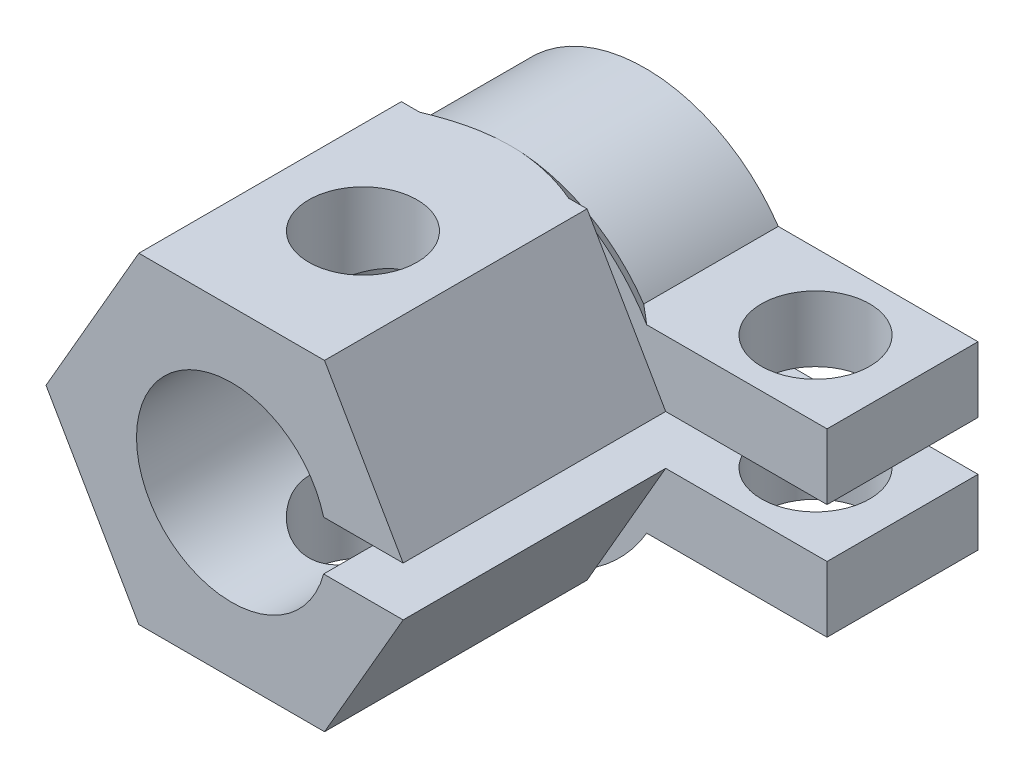
from build123d import *

# Parameters (mm, degrees)
CROQUIS1_R                 = 4.9
CROQUIS1_R_2               = 2.9
SALIENTE_EXTRUIR1_DEPTH    = 4.6
CORTAR_EXTRUIR2_DEPTH      = 0.75
CORTAR_EXTRUIR2_DEPTH_BACK = 0.75
CROQUIS2_W                 = 2.8
CROQUIS2_H                 = 4.6
CROQUIS4_R                 = 1.65
SALIENTE_EXTRUIR2_DEPTH    = 2
SALIENTE_EXTRUIR3_DEPTH    = 8
CORTAR_EXTRUIR3_DEPTH      = 19.912045786
CORTAR_EXTRUIR3_DEPTH_BACK = 19.912045786
CROQUIS6_R                 = 1.65
CHAFL_N1_SIZE              = 0.5


with BuildPart() as part:
    # Croquis1 → Saliente-Extruir1 (new body)
    with BuildSketch(Plane.XY):
        Circle(CROQUIS1_R)
        Circle(CROQUIS1_R_2, mode=Mode.SUBTRACT)
    extrude(amount=SALIENTE_EXTRUIR1_DEPTH)

    # Croquis2 → Cortar-Extruir2 (cut, two sides: drawn at the far end of the back side and taken through both)
    with BuildSketch(Plane(origin=(0, 0, 0), x_dir=(1, 0, 0), z_dir=(0, 1, 0)).offset(-CORTAR_EXTRUIR2_DEPTH_BACK)):
        with Locations((3.6, -2.3)):
            Rectangle(CROQUIS2_W, CROQUIS2_H)
    extrude(amount=CORTAR_EXTRUIR2_DEPTH + CORTAR_EXTRUIR2_DEPTH_BACK, mode=Mode.SUBTRACT)



with BuildPart() as body_2:
    # Croquis4 → Saliente-Extruir2 (new body)
    with BuildSketch(Plane(origin=(0, -0.75, 0), x_dir=(1, 0, 0), z_dir=(0, 1, 0))):
        Polygon((4.842261868, -4.6), (10.142261868, -4.6), (10.142261868, 0), (4.842261868, 0), (2.801338966, 0), (2.801338966, -4.6), align=None)
        with Locations(Location((7.492261868, -2.3, 0), (0, 0, 270))):
            Circle(CROQUIS4_R, mode=Mode.SUBTRACT)
    extrude(amount=-SALIENTE_EXTRUIR2_DEPTH)


with BuildPart() as body_3:
    # Simetría3: mirrored copy
    add(body_2.part.mirror(Plane.ZX))


with BuildPart() as part_1:
    add(part.part)

    add(body_2.part)  # Saliente-Extruir3 merges body 2

    add(body_3.part)  # Saliente-Extruir3 merges body 3
    # Croquis5 → Saliente-Extruir3 (add)
    with BuildSketch(Plane.XY.offset(4.6)):
        with BuildLine():
            ThreePointArc((2.801338966, -0.75), (-2.9, 0), (2.801338966, 0.75))
            Line((2.801338966, 0.75), (4.842261868, 0.75))
            ThreePointArc((4.842261868, 0.75), (-4.9, 0), (4.842261868, -0.75))
            Line((4.842261868, -0.75), (2.801338966, -0.75))
        make_face()
        with BuildLine():
            Line((-2.829016319, 4.9), (-4.243524531, 2.449999908))
            ThreePointArc((-4.243524531, 2.449999908), (-2.450000051, 4.243524449), (-1.2e-08, 4.9))
            Line((-1.2e-08, 4.9), (-2.829016319, 4.9))
        make_face()
        with BuildLine():
            Line((-5.658032638, 0), (-4.243524553, -2.449999871))
            ThreePointArc((-4.243524553, -2.449999871), (-4.9, 2.1e-08), (-4.243524531, 2.449999908))
            Line((-4.243524531, 2.449999908), (-5.658032638, 0))
        make_face()
        with BuildLine():
            Line((-2.829016319, -4.9), (-1.5e-08, -4.9))
            ThreePointArc((-1.5e-08, -4.9), (-2.450000071, -4.243524438), (-4.243524553, -2.449999871))
            Line((-4.243524553, -2.449999871), (-2.829016319, -4.9))
        make_face()
        with BuildLine():
            Line((-1.5e-08, -4.9), (2.829016319, -4.9))
            Line((2.829016319, -4.9), (4.24352445, -2.45000005))
            ThreePointArc((4.24352445, -2.45000005), (2.449999969, -4.243524497), (-1.5e-08, -4.9))
        make_face()
        with BuildLine():
            Line((2.829016319, 4.9), (-1.2e-08, 4.9))
            ThreePointArc((-1.2e-08, 4.9), (2.450000039, 4.243524456), (4.243524529, 2.449999913))
            Line((4.243524529, 2.449999913), (2.829016319, 4.9))
        make_face()
        with BuildLine():
            Line((4.842261868, 0.75), (5.225019936, 0.75))
            Line((5.225019936, 0.75), (4.243524529, 2.449999913))
            ThreePointArc((4.243524529, 2.449999913), (4.621728956, 1.627765788), (4.842261868, 0.75))
        make_face()
        with BuildLine():
            ThreePointArc((4.842261868, -0.75), (4.621728929, -1.627765863), (4.24352445, -2.45000005))
            Line((4.24352445, -2.45000005), (5.225019936, -0.75))
            Line((5.225019936, -0.75), (4.842261868, -0.75))
        make_face()
    extrude(amount=SALIENTE_EXTRUIR3_DEPTH)

    # Croquis6 → Cortar-Extruir3 (cut, two sides: drawn at the far end of the back side and taken through both)
    with BuildSketch(Plane.XZ.offset(4.9).offset(-CORTAR_EXTRUIR3_DEPTH_BACK)):
        with Locations((0, 8.6)):
            Circle(CROQUIS6_R)
    extrude(amount=CORTAR_EXTRUIR3_DEPTH + CORTAR_EXTRUIR3_DEPTH_BACK, mode=Mode.SUBTRACT)

    # Chaflán1
    # the kernel refuses this chamfer: 0.5 mm, written as the material it adds along each edge
    with BuildSketch(Plane(origin=(0, 0, 4.6), x_dir=(0, 1, 0), z_dir=(1, 0, 0))) as chafl_n1_piece_1_section:
        Polygon((4.9 + CHAFL_N1_SIZE, 0), (4.9, -CHAFL_N1_SIZE), (4.9, 0), align=None)
    chafl_n1_piece_1 = revolve(axis=Axis((0, 0, 4.6), (0, 0, 1)), revolution_arc=59.999998828, mode=Mode.PRIVATE)
    chafl_n1_piece_1 = split(chafl_n1_piece_1, bisect_by=Plane(origin=(-2.470137352, 4.9, 4.415231156), z_dir=(0, -1, 0)), keep=Keep.TOP, mode=Mode.PRIVATE)
    chafl_n1_piece_1 = split(chafl_n1_piece_1, bisect_by=Plane(origin=(-3.008455802, 4.589201698, 4.415231156), z_dir=(0.8660254037844386, -0.5000000000000002, 0)), keep=Keep.TOP, mode=Mode.PRIVATE)
    add(chafl_n1_piece_1)
    with BuildSketch(Plane(origin=(0, 0, 4.6), x_dir=(-0.8660253935532619, 0.5000000177209175, 0), z_dir=(0.5000000177209175, 0.8660253935532619, 0))) as chafl_n1_piece_2_section:
        Polygon((4.9 + CHAFL_N1_SIZE, 0), (4.9, -CHAFL_N1_SIZE), (4.9, 0), align=None)
    chafl_n1_piece_2 = revolve(axis=Axis((0, 0, 4.6), (0, 0, 1)), revolution_arc=59.99999929, mode=Mode.PRIVATE)
    chafl_n1_piece_2 = split(chafl_n1_piece_2, bisect_by=Plane(origin=(-5.478593155, 0.310798302, 4.415231156), z_dir=(0.8660254037844386, -0.5000000000000002, 0)), keep=Keep.TOP, mode=Mode.PRIVATE)
    chafl_n1_piece_2 = split(chafl_n1_piece_2, bisect_by=Plane(origin=(-5.478593155, -0.310798302, 4.415231156), z_dir=(0.8660254037844386, 0.5000000000000002, 0)), keep=Keep.TOP, mode=Mode.PRIVATE)
    add(chafl_n1_piece_2)
    with BuildSketch(Plane(origin=(0, 0, 4.6), x_dir=(-0.8660254202095417, -0.4999999715508861, 0), z_dir=(-0.4999999715508861, 0.8660254202095417, 0))) as chafl_n1_piece_3_section:
        Polygon((4.9 + CHAFL_N1_SIZE, 0), (4.9, -CHAFL_N1_SIZE), (4.9, 0), align=None)
    chafl_n1_piece_3 = revolve(axis=Axis((0, 0, 4.6), (0, 0, 1)), revolution_arc=60.000001882, mode=Mode.PRIVATE)
    chafl_n1_piece_3 = split(chafl_n1_piece_3, bisect_by=Plane(origin=(-3.008455802, -4.589201698, 4.415231156), z_dir=(0.8660254037844386, 0.5000000000000002, 0)), keep=Keep.TOP, mode=Mode.PRIVATE)
    chafl_n1_piece_3 = split(chafl_n1_piece_3, bisect_by=Plane(origin=(-2.470137352, -4.9, 4.415231156), z_dir=(0, 1, 0)), keep=Keep.TOP, mode=Mode.PRIVATE)
    add(chafl_n1_piece_3)
    with BuildSketch(Plane(origin=(0, 0, 4.6), x_dir=(0, -1, 0), z_dir=(-1, 0, 0))) as chafl_n1_piece_4_section:
        Polygon((4.9 + CHAFL_N1_SIZE, 0), (4.9, -CHAFL_N1_SIZE), (4.9, 0), align=None)
    chafl_n1_piece_4 = revolve(axis=Axis((0, 0, 4.6), (0, 0, 1)), revolution_arc=70.897169979, mode=Mode.PRIVATE)
    chafl_n1_piece_4 = split(chafl_n1_piece_4, bisect_by=Plane(origin=(2.466837368, -4.9, 4.415358811), z_dir=(0, 1, 0)), keep=Keep.TOP, mode=Mode.PRIVATE)
    add(chafl_n1_piece_4)
    with BuildSketch(Plane(origin=(0, 0, 4.6), x_dir=(0.9449327486717788, 0.3272645726130418, 0), z_dir=(0.3272645726130418, -0.9449327486717788, 0))) as chafl_n1_piece_5_section:
        Polygon((4.9 + CHAFL_N1_SIZE, 0), (4.9, -CHAFL_N1_SIZE), (4.9, 0), align=None)
    chafl_n1_piece_5 = revolve(axis=Axis((0, 0, 4.6), (0, 0, 1)), revolution_arc=70.897169979, mode=Mode.PRIVATE)
    chafl_n1_piece_5 = split(chafl_n1_piece_5, bisect_by=Plane(origin=(3.940959453, 4.9, 4.468069459), z_dir=(0, -1, 0)), keep=Keep.TOP, mode=Mode.PRIVATE)
    add(chafl_n1_piece_5)


solid = part_1.part
